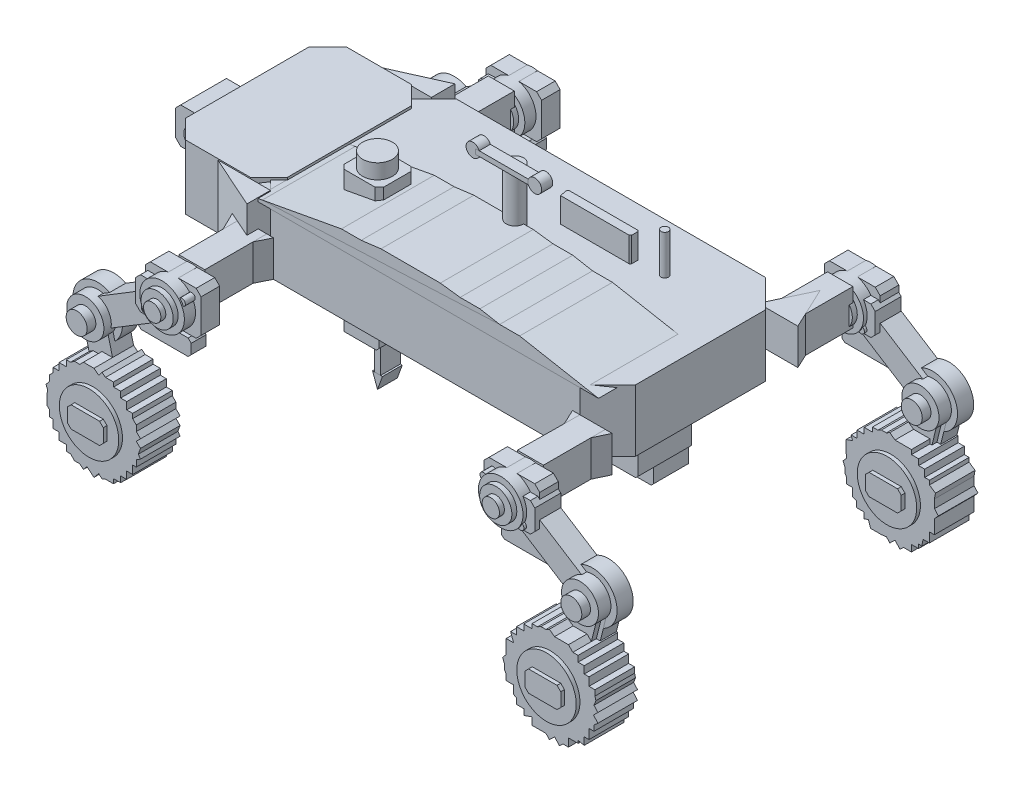
from build123d import *

# Parameters (mm, degrees)
V5_1_THICKER_CHAMFERED_MAIN_CHASSIS_DEPTH      = 100
V5_1_PROJECTING_FRONT_SENSOR_HEAD_DEPTH        = 104
V5_7_FRONT_NEAR_SHOULDER_DIAGONAL_FILL_N_DEPTH = 102
V5_7_FRONT_FAR_SHOULDER_DIAGONAL_FILL_NO_DEPTH = 102
SKETCH_5_W                                     = 42
SKETCH_5_H                                     = 100
V5_17_FRONT_NEAR_SIDE_100MM_OUTBOARD_BEA_DEPTH = 58
SKETCH_6_W                                     = 41
SKETCH_6_H                                     = 100
V5_17_REAR_NEAR_SIDE_100MM_OUTBOARD_BEAM_DEPTH = 58
SKETCH_7_W                                     = 42
SKETCH_7_H                                     = 100
V5_17_FRONT_FAR_SIDE_100MM_OUTBOARD_BEAM_DEPTH = 58
V5_17_REAR_FAR_SIDE_100MM_OUTBOARD_BEAM_DEPTH  = 58
V5_13_FRONT_NEAR_SIDE_COMPACT_ROOT_GUSSE_DEPTH = 58
V5_13_REAR_NEAR_SIDE_COMPACT_ROOT_GUSSET_DEPTH = 58
V5_13_FRONT_FAR_SIDE_COMPACT_ROOT_GUSSET_DEPTH = 58
V5_13_REAR_FAR_SIDE_COMPACT_ROOT_GUSSET_DEPTH  = 58
V5_1_NEAR_SEGMENTED_CURVED_UPPER_SHELL_DEPTH   = 150
V5_1_FAR_SEGMENTED_CURVED_UPPER_SHELL_DEPTH    = 150
V5_1_RECESSED_SIDE_PANEL_FRAME_DEPTH           = 74
V5_1_BATTERY_ELECTRONICS_PANEL_INSERT_DEPTH    = 82
V5_7_INTEGRATED_LOWER_SIDE_SKIRT_NO_LONG_DEPTH = 86
V5_7_PROTECTED_UNDERBODY_PAYLOAD_BAY_JOI_DEPTH = 60
V5_7_FRONT_SKID_VERTICAL_SUPPORT_JOINED_DEPTH  = 56
V5_7_CENTER_SKID_VERTICAL_SUPPORT_JOINED_DEPTH = 56
V5_7_REAR_SKID_VERTICAL_SUPPORT_JOINED_DEPTH   = 56
V5_1_FRONT_STEREO_CAMERA_BEZEL_DEPTH           = 74
SKETCH_23_R                                    = 15
V5_1_LEFT_RGB_CAMERA_LENS_DEPTH                = 84
SKETCH_24_R                                    = 15
V5_1_RIGHT_DEPTH_CAMERA_LENS_DEPTH             = 84
FRONT_NEAR_LEG_SIDE_HIP_MOUNT_PLATE_DEPTH      = 30
FRONT_NEAR_LEG_SIDE_FORK_CLEVIS_BLOCK_DEPTH    = 42
FRONT_NEAR_LEG_SIDE_CHAMFERED_GUSSET_BLO_DEPTH = 24
SKETCH_28_R                                    = 5.5
FRONT_NEAR_LEG_SIDE_UPPER_MOUNT_BOLT_DEPTH     = 46
SKETCH_29_R                                    = 5.5
FRONT_NEAR_LEG_SIDE_LOWER_MOUNT_BOLT_DEPTH     = 46
FRONT_NEAR_LEG_SIDE_UPPER_PARALLEL_LINK_DEPTH  = 34
FRONT_NEAR_LEG_SIDE_INNER_UPPER_LINK_DEPTH     = 26
FRONT_NEAR_LEG_SIDE_LOWER_PARALLEL_LINK_DEPTH  = 34
FRONT_NEAR_LEG_SIDE_INNER_LOWER_LINK_DEPTH     = 26
SKETCH_34_R                                    = 36
FRONT_NEAR_LEG_SIDE_HIP_JOINT_POD_DEPTH        = 48
SKETCH_35_R                                    = 26
FRONT_NEAR_LEG_SIDE_HIP_ANGLE_CONTROL_WA_DEPTH = 56
SKETCH_36_R                                    = 14
FRONT_NEAR_LEG_SIDE_HIP_PIN_CAP_DEPTH          = 64
SKETCH_37_R                                    = 30
FRONT_NEAR_LEG_SIDE_KNEE_JOINT_POD_DEPTH       = 46
SKETCH_38_R                                    = 40
FRONT_NEAR_LEG_SIDE_KNEE_OUTER_ANGLE_PLA_DEPTH = 26
SKETCH_39_R                                    = 17
FRONT_NEAR_LEG_SIDE_KNEE_PIN_CAP_DEPTH         = 60
SKETCH_40_R                                    = 30
FRONT_NEAR_LEG_SIDE_AXLE_JOINT_POD_DEPTH       = 46
SKETCH_41_R                                    = 21
FRONT_NEAR_LEG_SIDE_AXLE_PIN_CAP_DEPTH         = 58
FRONT_NEAR_LEG_SIDE_MOUNTED_BLOCK_TREAD_DEPTH  = 64
SKETCH_43_R                                    = 48
FRONT_NEAR_LEG_SIDE_SILVER_HUB_DISC_DEPTH      = 70
FRONT_NEAR_LEG_SIDE_RECTANGULAR_HUB_CAP_DEPTH  = 76
REAR_NEAR_LEG_SIDE_HIP_MOUNT_PLATE_DEPTH       = 30
REAR_NEAR_LEG_SIDE_FORK_CLEVIS_BLOCK_DEPTH     = 42
REAR_NEAR_LEG_SIDE_CHAMFERED_GUSSET_BLOC_DEPTH = 24
SKETCH_48_R                                    = 5.5
REAR_NEAR_LEG_SIDE_UPPER_MOUNT_BOLT_DEPTH      = 46
SKETCH_49_R                                    = 5.5
REAR_NEAR_LEG_SIDE_LOWER_MOUNT_BOLT_DEPTH      = 46
REAR_NEAR_LEG_SIDE_UPPER_PARALLEL_LINK_DEPTH   = 34
REAR_NEAR_LEG_SIDE_INNER_UPPER_LINK_DEPTH      = 26
REAR_NEAR_LEG_SIDE_LOWER_PARALLEL_LINK_DEPTH   = 34
REAR_NEAR_LEG_SIDE_INNER_LOWER_LINK_DEPTH      = 26
SKETCH_54_R                                    = 36
REAR_NEAR_LEG_SIDE_HIP_JOINT_POD_DEPTH         = 48
SKETCH_55_R                                    = 26
REAR_NEAR_LEG_SIDE_HIP_ANGLE_CONTROL_WAS_DEPTH = 56
SKETCH_56_R                                    = 14
REAR_NEAR_LEG_SIDE_HIP_PIN_CAP_DEPTH           = 64
SKETCH_57_R                                    = 29.877507243
REAR_NEAR_LEG_SIDE_KNEE_JOINT_POD_DEPTH        = 46
SKETCH_58_R                                    = 40
REAR_NEAR_LEG_SIDE_KNEE_OUTER_ANGLE_PLAT_DEPTH = 26
SKETCH_59_R                                    = 17
REAR_NEAR_LEG_SIDE_KNEE_PIN_CAP_DEPTH          = 60
SKETCH_60_R                                    = 30.007079554
REAR_NEAR_LEG_SIDE_AXLE_JOINT_POD_DEPTH        = 46
SKETCH_61_R                                    = 21
REAR_NEAR_LEG_SIDE_AXLE_PIN_CAP_DEPTH          = 58
REAR_NEAR_LEG_SIDE_MOUNTED_BLOCK_TREAD_T_DEPTH = 64
SKETCH_63_R                                    = 48
REAR_NEAR_LEG_SIDE_SILVER_HUB_DISC_DEPTH       = 70
REAR_NEAR_LEG_SIDE_RECTANGULAR_HUB_CAP_DEPTH   = 76
FRONT_FAR_LEG_SIDE_HIP_MOUNT_PLATE_DEPTH       = 30
FRONT_FAR_LEG_SIDE_FORK_CLEVIS_BLOCK_DEPTH     = 42
FRONT_FAR_LEG_SIDE_CHAMFERED_GUSSET_BLOC_DEPTH = 24
SKETCH_68_R                                    = 5.555512755
FRONT_FAR_LEG_SIDE_UPPER_MOUNT_BOLT_DEPTH      = 46
SKETCH_69_R                                    = 5.5
FRONT_FAR_LEG_SIDE_LOWER_MOUNT_BOLT_DEPTH      = 46
FRONT_FAR_LEG_SIDE_UPPER_PARALLEL_LINK_DEPTH   = 34
FRONT_FAR_LEG_SIDE_INNER_UPPER_LINK_DEPTH      = 26
FRONT_FAR_LEG_SIDE_LOWER_PARALLEL_LINK_DEPTH   = 34
FRONT_FAR_LEG_SIDE_INNER_LOWER_LINK_DEPTH      = 26
SKETCH_74_R                                    = 36
FRONT_FAR_LEG_SIDE_HIP_JOINT_POD_DEPTH         = 48
SKETCH_75_R                                    = 26
FRONT_FAR_LEG_SIDE_HIP_ANGLE_CONTROL_WAS_DEPTH = 56
SKETCH_76_R                                    = 14
FRONT_FAR_LEG_SIDE_HIP_PIN_CAP_DEPTH           = 64
SKETCH_77_R                                    = 30
FRONT_FAR_LEG_SIDE_KNEE_JOINT_POD_DEPTH        = 46
SKETCH_78_R                                    = 40
FRONT_FAR_LEG_SIDE_KNEE_OUTER_ANGLE_PLAT_DEPTH = 26
SKETCH_79_R                                    = 17
FRONT_FAR_LEG_SIDE_KNEE_PIN_CAP_DEPTH          = 60
SKETCH_80_R                                    = 30
FRONT_FAR_LEG_SIDE_AXLE_JOINT_POD_DEPTH        = 46
SKETCH_81_R                                    = 21
FRONT_FAR_LEG_SIDE_AXLE_PIN_CAP_DEPTH          = 58
FRONT_FAR_LEG_SIDE_MOUNTED_BLOCK_TREAD_T_DEPTH = 64
SKETCH_83_R                                    = 48
FRONT_FAR_LEG_SIDE_SILVER_HUB_DISC_DEPTH       = 70
FRONT_FAR_LEG_SIDE_RECTANGULAR_HUB_CAP_DEPTH   = 76
REAR_FAR_LEG_SIDE_HIP_MOUNT_PLATE_DEPTH        = 30
REAR_FAR_LEG_SIDE_FORK_CLEVIS_BLOCK_DEPTH      = 42
REAR_FAR_LEG_SIDE_CHAMFERED_GUSSET_BLOCK_DEPTH = 24
SKETCH_88_R                                    = 5.5
REAR_FAR_LEG_SIDE_UPPER_MOUNT_BOLT_DEPTH       = 46
SKETCH_89_R                                    = 5.566740906
REAR_FAR_LEG_SIDE_LOWER_MOUNT_BOLT_DEPTH       = 46
REAR_FAR_LEG_SIDE_UPPER_PARALLEL_LINK_DEPTH    = 34
REAR_FAR_LEG_SIDE_INNER_UPPER_LINK_DEPTH       = 26
REAR_FAR_LEG_SIDE_LOWER_PARALLEL_LINK_DEPTH    = 34
REAR_FAR_LEG_SIDE_INNER_LOWER_LINK_DEPTH       = 26
SKETCH_94_R                                    = 36
REAR_FAR_LEG_SIDE_HIP_JOINT_POD_DEPTH          = 48
SKETCH_95_R                                    = 26
REAR_FAR_LEG_SIDE_HIP_ANGLE_CONTROL_WASH_DEPTH = 56
SKETCH_96_R                                    = 14
REAR_FAR_LEG_SIDE_HIP_PIN_CAP_DEPTH            = 64
SKETCH_97_R                                    = 30
REAR_FAR_LEG_SIDE_KNEE_JOINT_POD_DEPTH         = 46
SKETCH_98_R                                    = 40
REAR_FAR_LEG_SIDE_KNEE_OUTER_ANGLE_PLATE_DEPTH = 26
SKETCH_99_R                                    = 17
REAR_FAR_LEG_SIDE_KNEE_PIN_CAP_DEPTH           = 60
SKETCH_100_R                                   = 30
REAR_FAR_LEG_SIDE_AXLE_JOINT_POD_DEPTH         = 46
SKETCH_101_R                                   = 21
REAR_FAR_LEG_SIDE_AXLE_PIN_CAP_DEPTH           = 58
REAR_FAR_LEG_SIDE_MOUNTED_BLOCK_TREAD_TI_DEPTH = 64
SKETCH_103_R                                   = 48
REAR_FAR_LEG_SIDE_SILVER_HUB_DISC_DEPTH        = 70
REAR_FAR_LEG_SIDE_RECTANGULAR_HUB_CAP_DEPTH    = 76
V5_1_ROOF_LIDAR_RTK_BASE_DEPTH                 = 142
SKETCH_106_R                                   = 24
V5_1_LIDAR_RTK_CYLINDRICAL_PUCK_DEPTH          = 166
SKETCH_107_R                                   = 14
V5_1_TALL_ENVIRONMENT_WEATHER_MAST_DEPTH       = 208
SKETCH_108_W                                   = 92
SKETCH_108_H                                   = 8
V5_1_ANEMOMETER_CROSSBAR_DEPTH                 = 18
SKETCH_109_R                                   = 11
V5_1_LEFT_WIND_CUP_DEPTH                       = 18
SKETCH_110_R                                   = 11
V5_1_RIGHT_WIND_CUP_DEPTH                      = 18
SKETCH_111_R                                   = 6
V5_1_SHORT_TELEMETRY_ANTENNA_DEPTH             = 164
V5_1_SILVER_TOP_SERVICE_HANDLE_BAR_DEPTH       = 140
V5_7_SOIL_PROBE_MOUNTING_COLLAR_JOINED_T_DEPTH = 60
SKETCH_114_W                                   = 10
SKETCH_114_H                                   = 92
V5_1_DOWNWARD_SOIL_MOISTURE_PROBE_ROD_DEPTH    = 32
V5_1_SOIL_PROBE_TAPERED_TIP_DEPTH              = 32


with BuildPart() as part:
    # 草图1 → v5_1_thicker_chamfered_main_chassis (new body)
    with BuildSketch(Plane(origin=(0, 0, 0), x_dir=(1, 0, 0), z_dir=(0, 1, 0))):
        Polygon((-225, -150), (275, -150), (320, -105), (320, 105), (275, 150), (-225, 150), (-270, 105), (-270, -105), align=None)
    extrude(amount=V5_1_THICKER_CHAMFERED_MAIN_CHASSIS_DEPTH)

    # 草图17 → v5_7_integrated_lower_side_skirt_no_long_gap (add)
    with BuildSketch(Plane.XY):
        Polygon((-191, -49), (301, -49), (305, -45), (305, 9), (301, 13), (-191, 13), (-195, 9), (-195, -45), align=None)
    extrude(amount=V5_7_INTEGRATED_LOWER_SIDE_SKIRT_NO_LONG_DEPTH)

    # 草图18 → v5_7_protected_underbody_payload_bay_joined (add)
    with BuildSketch(Plane.XY):
        Polygon((-135, -76), (15, -76), (20, -71), (20, -37), (15, -32), (-135, -32), (-140, -37), (-140, -71), align=None)
    extrude(amount=V5_7_PROTECTED_UNDERBODY_PAYLOAD_BAY_JOI_DEPTH)

    # 草图19 → v5_7_front_skid_vertical_support_joined (add)
    with BuildSketch(Plane.XY):
        Polygon((-181, -77), (-159, -77), (-155, -73), (-155, -15), (-159, -11), (-181, -11), (-185, -15), (-185, -73), align=None)
    extrude(amount=V5_7_FRONT_SKID_VERTICAL_SUPPORT_JOINED_DEPTH)

    # 草图20 → v5_7_center_skid_vertical_support_joined (add)
    with BuildSketch(Plane.XY):
        Polygon((29, -77), (51, -77), (55, -73), (55, -15), (51, -11), (29, -11), (25, -15), (25, -73), align=None)
    extrude(amount=V5_7_CENTER_SKID_VERTICAL_SUPPORT_JOINED_DEPTH)

    # 草图21 → v5_7_rear_skid_vertical_support_joined (add)
    with BuildSketch(Plane.XY):
        Polygon((274, -77), (296, -77), (300, -73), (300, -15), (296, -11), (274, -11), (270, -15), (270, -73), align=None)
    extrude(amount=V5_7_REAR_SKID_VERTICAL_SUPPORT_JOINED_DEPTH)

    # 草图113 → v5_7_soil_probe_mounting_collar_joined_to_underbody (add)
    with BuildSketch(Plane.XY):
        Polygon((-196, -106), (-144, -106), (-140, -102), (-140, -46), (-144, -42), (-195, -42), (-196, -42), align=None)
    extrude(amount=V5_7_SOIL_PROBE_MOUNTING_COLLAR_JOINED_T_DEPTH)


with BuildPart() as body_2:
    # 草图2 → v5_1_projecting_front_sensor_head (new body)
    with BuildSketch(Plane(origin=(0, 0, 0), x_dir=(1, 0, 0), z_dir=(0, 1, 0))):
        Polygon((-382.5, -130), (-277.5, -130), (-247.5, -100), (-247.5, 100), (-277.5, 130), (-382.5, 130), (-412.5, 100), (-412.5, -100), align=None)
    extrude(amount=V5_1_PROJECTING_FRONT_SENSOR_HEAD_DEPTH)


with BuildPart() as body_3:
    # 草图3 → v5_7_front_near_shoulder_diagonal_fill_no_gap (new body)
    with BuildSketch(Plane(origin=(0, 0, 0), x_dir=(1, 0, 0), z_dir=(0, 1, 0))):
        Polygon((-330, 130), (-245, 130), (-245, 168), align=None)
    extrude(amount=V5_7_FRONT_NEAR_SHOULDER_DIAGONAL_FILL_N_DEPTH)


with BuildPart() as body_4:
    # 草图4 → v5_7_front_far_shoulder_diagonal_fill_no_gap (new body)
    with BuildSketch(Plane(origin=(0, 0, 0), x_dir=(1, 0, 0), z_dir=(0, 1, 0))):
        Polygon((-330, -130), (-245, -130), (-245, -168), align=None)
    extrude(amount=V5_7_FRONT_FAR_SHOULDER_DIAGONAL_FILL_NO_DEPTH)


with BuildPart() as body_5:
    # 草图5 → v5_17_front_near_side_100mm_outboard_beam_connected (new body)
    with BuildSketch(Plane(origin=(0, 0, 0), x_dir=(1, 0, 0), z_dir=(0, 1, 0))):
        with Locations((-252, 200)):
            Rectangle(SKETCH_5_W, SKETCH_5_H)
    extrude(amount=V5_17_FRONT_NEAR_SIDE_100MM_OUTBOARD_BEA_DEPTH)


with BuildPart() as body_6:
    # 草图6 → v5_17_rear_near_side_100mm_outboard_beam_connected (new body)
    with BuildSketch(Plane(origin=(0, 0, 0), x_dir=(1, 0, 0), z_dir=(0, 1, 0))):
        with Locations((295.5, 200)):
            Rectangle(SKETCH_6_W, SKETCH_6_H)
    extrude(amount=V5_17_REAR_NEAR_SIDE_100MM_OUTBOARD_BEAM_DEPTH)


with BuildPart() as body_7:
    # 草图7 → v5_17_front_far_side_100mm_outboard_beam_connected (new body)
    with BuildSketch(Plane(origin=(0, 0, 0), x_dir=(1, 0, 0), z_dir=(0, 1, 0))):
        with Locations((-252, -200)):
            Rectangle(SKETCH_7_W, SKETCH_7_H)
    extrude(amount=V5_17_FRONT_FAR_SIDE_100MM_OUTBOARD_BEAM_DEPTH)


with BuildPart() as body_8:
    # 草图8 → v5_17_rear_far_side_100mm_outboard_beam_connected (new body)
    with BuildSketch(Plane(origin=(0, 0, 0), x_dir=(1, 0, 0), z_dir=(0, 1, 0))):
        Polygon((274, -250), (316, -250), (316, -150), (275, -150), align=None)
    extrude(amount=V5_17_REAR_FAR_SIDE_100MM_OUTBOARD_BEAM_DEPTH)


with BuildPart() as body_9:
    # 草图9 → v5_13_front_near_side_compact_root_gusset (new body)
    with BuildSketch(Plane(origin=(0, 0, 0), x_dir=(1, 0, 0), z_dir=(0, 1, 0))):
        Polygon((-287.5, 149), (-220, 150), (-253.75, 218), align=None)
    extrude(amount=V5_13_FRONT_NEAR_SIDE_COMPACT_ROOT_GUSSE_DEPTH)


with BuildPart() as body_10:
    # 草图10 → v5_13_rear_near_side_compact_root_gusset (new body)
    with BuildSketch(Plane(origin=(0, 0, 0), x_dir=(1, 0, 0), z_dir=(0, 1, 0))):
        Polygon((263, 150), (327, 150), (295, 218), align=None)
    extrude(amount=V5_13_REAR_NEAR_SIDE_COMPACT_ROOT_GUSSET_DEPTH)


with BuildPart() as body_11:
    # 草图11 → v5_13_front_far_side_compact_root_gusset (new body)
    with BuildSketch(Plane(origin=(0, 0, 0), x_dir=(1, 0, 0), z_dir=(0, 1, 0))):
        Polygon((-287.5, -149), (-220, -150), (-253.75, -218), align=None)
    extrude(amount=V5_13_FRONT_FAR_SIDE_COMPACT_ROOT_GUSSET_DEPTH)


with BuildPart() as body_12:
    # 草图12 → v5_13_rear_far_side_compact_root_gusset (new body)
    with BuildSketch(Plane(origin=(0, 0, 0), x_dir=(1, 0, 0), z_dir=(0, 1, 0))):
        Polygon((263, -150), (327, -150), (295, -218), align=None)
    extrude(amount=V5_13_REAR_FAR_SIDE_COMPACT_ROOT_GUSSET_DEPTH)


with BuildPart() as body_13:
    # 草图13 → v5_1_near_segmented_curved_upper_shell (new body)
    with BuildSketch(Plane.XY):
        Polygon((-270, 96), (305, 96), (273.055555556, 101.904038041), (241.14317141, 107.802150631), (209.293933726, 113.688592362), (177.537009993, 119.557972438), (145.277777778, 119.557972438), (113.333333333, 125.444863729), (81.388888889, 125.444863729), (49.444444444, 129.483463602), (17.5, 129.483463602), (-14.444444444, 129.483463602), (-46.388888889, 129.483463602), (-78.333333333, 125.444863729), (-110.277777778, 125.444863729), (-142.222222222, 119.557972438), (-174.071644358, 113.688592362), (-206.013649328, 107.802150631), (-238.018984687, 101.904038041), align=None)
    extrude(amount=V5_1_NEAR_SEGMENTED_CURVED_UPPER_SHELL_DEPTH)


with BuildPart() as body_14:
    # 草图14 → v5_1_far_segmented_curved_upper_shell (new body)
    with BuildSketch(Plane.XY):
        Polygon((-270, 96), (305, 96), (273.055555556, 101.904038041), (241.268504996, 107.778986219), (209.293933726, 113.688592362), (177.537009993, 119.557972438), (145.277777778, 119.557972438), (113.333333333, 125.444863729), (81.388888889, 125.444863729), (49.444444444, 129.483463602), (17.5, 129.483463602), (-14.444444444, 129.483463602), (-46.388888889, 129.483463602), (-78.333333333, 125.444863729), (-110.277777778, 125.444863729), (-142.222222222, 119.557972438), (-174.148381232, 113.674450885), (-206.139347974, 107.778986219), (-238.018984687, 101.904038041), align=None)
    extrude(amount=V5_1_FAR_SEGMENTED_CURVED_UPPER_SHELL_DEPTH)


with BuildPart() as body_15:
    # 草图15 → v5_1_recessed_side_panel_frame (new body)
    with BuildSketch(Plane.XY):
        Polygon((10.5, 14), (199.5, 14), (207.5, 22), (207.5, 82), (199.5, 90), (10.5, 90), (0, 79.5), (0, 22), align=None)
    extrude(amount=V5_1_RECESSED_SIDE_PANEL_FRAME_DEPTH)


with BuildPart() as body_16:
    # 草图16 → v5_1_battery_electronics_panel_insert (new body)
    with BuildSketch(Plane.XY):
        Polygon((31, 28), (179, 28), (184, 33), (184, 75), (179, 80), (31, 80), (26, 75), (26, 33), align=None)
    extrude(amount=V5_1_BATTERY_ELECTRONICS_PANEL_INSERT_DEPTH)


with BuildPart() as body_17:
    # 草图22 → v5_1_front_stereo_camera_bezel (new body)
    with BuildSketch(Plane.XY):
        Polygon((-446, 35), (-338, 35), (-330, 43), (-330, 85), (-338, 93), (-446, 93), (-454, 85), (-454, 43), align=None)
    extrude(amount=V5_1_FRONT_STEREO_CAMERA_BEZEL_DEPTH)


with BuildPart() as body_18:
    # 草图23 → v5_1_left_rgb_camera_lens (new body)
    with BuildSketch(Plane.XY):
        with Locations((-416, 66)):
            Circle(SKETCH_23_R)
    extrude(amount=V5_1_LEFT_RGB_CAMERA_LENS_DEPTH)


with BuildPart() as body_19:
    # 草图24 → v5_1_right_depth_camera_lens (new body)
    with BuildSketch(Plane.XY):
        with Locations((-370, 66)):
            Circle(SKETCH_24_R)
    extrude(amount=V5_1_RIGHT_DEPTH_CAMERA_LENS_DEPTH)


with BuildPart() as body_20:
    # 草图25 → front_near_leg_side_hip_mount_plate (new body)
    with BuildSketch(Plane.XY.offset(250)):
        Polygon((-289, -15), (-215, -15), (-207, -7), (-207, 47), (-215, 55), (-289, 55), (-297, 47), (-297, -7), align=None)
    extrude(amount=FRONT_NEAR_LEG_SIDE_HIP_MOUNT_PLATE_DEPTH)


with BuildPart() as body_21:
    # 草图26 → front_near_leg_side_fork_clevis_block (new body)
    with BuildSketch(Plane.XY.offset(250)):
        Polygon((-293, -11), (-246, -11), (-238, -3), (-238, 33), (-246, 41), (-293, 41), (-301, 33), (-301, -3), align=None)
    extrude(amount=FRONT_NEAR_LEG_SIDE_FORK_CLEVIS_BLOCK_DEPTH)


with BuildPart() as body_22:
    # 草图27 → front_near_leg_side_chamfered_gusset_block (new body)
    with BuildSketch(Plane.XY.offset(250)):
        Polygon((-310, -53), (-234, -53), (-229, -48), (-229, -32), (-234, -27), (-310, -27), (-315, -32), (-315, -48), align=None)
    extrude(amount=FRONT_NEAR_LEG_SIDE_CHAMFERED_GUSSET_BLO_DEPTH)


with BuildPart() as body_23:
    # 草图28 → front_near_leg_side_upper_mount_bolt (new body)
    with BuildSketch(Plane.XY.offset(250)):
        with Locations((-222, 40)):
            Circle(SKETCH_28_R)
    extrude(amount=FRONT_NEAR_LEG_SIDE_UPPER_MOUNT_BOLT_DEPTH)


with BuildPart() as body_24:
    # 草图29 → front_near_leg_side_lower_mount_bolt (new body)
    with BuildSketch(Plane.XY.offset(250)):
        with Locations((-282, 0)):
            Circle(SKETCH_29_R)
    extrude(amount=FRONT_NEAR_LEG_SIDE_LOWER_MOUNT_BOLT_DEPTH)


with BuildPart() as body_25:
    # 草图30 → front_near_leg_side_upper_parallel_link (new body)
    with BuildSketch(Plane.XY.offset(250)):
        Polygon((-241.279837267, 0), (-367.279837267, -76.884256305), (-388.111687363, -42.744456581), (-261.334784086, 34.613860284), align=None)
    extrude(amount=FRONT_NEAR_LEG_SIDE_UPPER_PARALLEL_LINK_DEPTH)


with BuildPart() as body_26:
    # 草图31 → front_near_leg_side_inner_upper_link (new body)
    with BuildSketch(Plane.XY.offset(250)):
        Polygon((-262.17592677, 0), (-388.17592677, -77.597915337), (-397.614039026, -62.272733739), (-270.751527953, 15.856364623), align=None)
    extrude(amount=FRONT_NEAR_LEG_SIDE_INNER_UPPER_LINK_DEPTH)


with BuildPart() as body_27:
    # 草图32 → front_near_leg_side_lower_parallel_link (new body)
    with BuildSketch(Plane.XY.offset(250)):
        Polygon((-358.597149997, -55.149287499), (-328.597149997, -175.149287499), (-367.402850003, -184.850712501), (-396.404882451, -64.236107726), align=None)
    extrude(amount=FRONT_NEAR_LEG_SIDE_LOWER_PARALLEL_LINK_DEPTH)


with BuildPart() as body_28:
    # 草图33 → front_near_leg_side_inner_lower_link (new body)
    with BuildSketch(Plane.XY.offset(250)):
        Polygon((-384.268717499, -67.817179375), (-354.268717499, -187.817179375), (-369.268717499, -191.567179375), (-399.268717499, -71.567179375), align=None)
    extrude(amount=FRONT_NEAR_LEG_SIDE_INNER_LOWER_LINK_DEPTH)


with BuildPart() as body_29:
    # 草图34 → front_near_leg_side_hip_joint_pod (new body)
    with BuildSketch(Plane.XY.offset(250)):
        with Locations((-252, 20)):
            Circle(SKETCH_34_R)
    extrude(amount=FRONT_NEAR_LEG_SIDE_HIP_JOINT_POD_DEPTH)


with BuildPart() as body_30:
    # 草图35 → front_near_leg_side_hip_angle_control_washer (new body)
    with BuildSketch(Plane.XY.offset(250)):
        with Locations((-252, 20)):
            Circle(SKETCH_35_R)
    extrude(amount=FRONT_NEAR_LEG_SIDE_HIP_ANGLE_CONTROL_WA_DEPTH)


with BuildPart() as body_31:
    # 草图36 → front_near_leg_side_hip_pin_cap (new body)
    with BuildSketch(Plane.XY.offset(250)):
        with Locations((-252, 20)):
            Circle(SKETCH_36_R)
    extrude(amount=FRONT_NEAR_LEG_SIDE_HIP_PIN_CAP_DEPTH)


with BuildPart() as body_32:
    # 草图37 → front_near_leg_side_knee_joint_pod (new body)
    with BuildSketch(Plane.XY.offset(250)):
        with Locations((-378, -60)):
            Circle(SKETCH_37_R)
    extrude(amount=FRONT_NEAR_LEG_SIDE_KNEE_JOINT_POD_DEPTH)


with BuildPart() as body_33:
    # 草图38 → front_near_leg_side_knee_outer_angle_plate (new body)
    with BuildSketch(Plane.XY.offset(250)):
        with Locations((-378, -60)):
            Circle(SKETCH_38_R)
    extrude(amount=FRONT_NEAR_LEG_SIDE_KNEE_OUTER_ANGLE_PLA_DEPTH)


with BuildPart() as body_34:
    # 草图39 → front_near_leg_side_knee_pin_cap (new body)
    with BuildSketch(Plane.XY.offset(250)):
        with Locations((-378, -60)):
            Circle(SKETCH_39_R)
    extrude(amount=FRONT_NEAR_LEG_SIDE_KNEE_PIN_CAP_DEPTH)


with BuildPart() as body_35:
    # 草图40 → front_near_leg_side_axle_joint_pod (new body)
    with BuildSketch(Plane.XY.offset(250)):
        with Locations((-348, -180)):
            Circle(SKETCH_40_R)
    extrude(amount=FRONT_NEAR_LEG_SIDE_AXLE_JOINT_POD_DEPTH)


with BuildPart() as body_36:
    # 草图41 → front_near_leg_side_axle_pin_cap (new body)
    with BuildSketch(Plane.XY.offset(250)):
        with Locations((-348, -180)):
            Circle(SKETCH_41_R)
    extrude(amount=FRONT_NEAR_LEG_SIDE_AXLE_PIN_CAP_DEPTH)


with BuildPart() as body_37:
    # 草图42 → front_near_leg_side_mounted_block_tread_tire (new body)
    with BuildSketch(Plane.XY.offset(250)):
        Polygon((-271, -180), (-277.650550685, -173.349449315), (-270.879339992, -166.578238622), (-277.650550685, -159.807027929), (-277.650550685, -150.533375708), (-283.518342469, -144.665583923), (-283.518342469, -137.221092057), (-293.116257811, -137.221092057), (-293.116257811, -125.552777849), (-302.958076824, -125.552777849), (-302.958076824, -115.976839853), (-314.530831685, -115.976839853), (-314.530831685, -108.861275997), (-327.389787915, -108.861275997), (-332.978045205, -104.479533409), (-338.408784826, -111.405629515), (-346.026280737, -105.432764539), (-354.959216963, -105.432764539), (-363.021954795, -105.432764539), (-368.994819772, -111.405629515), (-377.466624292, -111.405629515), (-383.963715854, -115.976839853), (-390.778907943, -115.976839853), (-390.778907943, -125.552777849), (-402.447222151, -125.552777849), (-402.447222151, -137.221092057), (-412.023160147, -137.221092057), (-412.023160147, -144.665583923), (-417.890951932, -150.533375708), (-417.890951932, -159.807027929), (-423.520466591, -166.578238622), (-420.705709261, -173.349449315), (-422.113087926, -180), (-422.113087926, -186.959216963), (-422.113087926, -195.021954795), (-417.890951932, -199.24409079), (-417.890951932, -209.466624292), (-412.023160147, -209.466624292), (-412.023160147, -222.778907943), (-402.447222151, -222.778907943), (-402.447222151, -234.447222151), (-390.778907943, -234.447222151), (-390.778907943, -244.023160147), (-383.963715854, -244.023160147), (-377.466624292, -250.520251709), (-368.994819772, -250.520251709), (-363.021954795, -255.520466591), (-357.306422913, -248.693139964), (-346.026280737, -258.136369469), (-338.408784826, -249.037105615), (-332.978045205, -253.583477445), (-327.389787915, -251.31029153), (-314.530831685, -251.31029153), (-314.530831685, -244.023160147), (-302.958076824, -244.023160147), (-302.958076824, -234.447222151), (-293.116257811, -234.447222151), (-293.116257811, -222.778907943), (-283.518342469, -222.778907943), (-283.518342469, -209.466624292), (-277.650550685, -209.466624292), (-277.650550685, -199.24409079), (-271, -195.021954795), (-274.325275342, -189.784105461), align=None)
    extrude(amount=FRONT_NEAR_LEG_SIDE_MOUNTED_BLOCK_TREAD_DEPTH)


with BuildPart() as body_38:
    # 草图43 → front_near_leg_side_silver_hub_disc (new body)
    with BuildSketch(Plane.XY.offset(250)):
        with Locations((-348, -180)):
            Circle(SKETCH_43_R)
    extrude(amount=FRONT_NEAR_LEG_SIDE_SILVER_HUB_DISC_DEPTH)


with BuildPart() as body_39:
    # 草图44 → front_near_leg_side_rectangular_hub_cap (new body)
    with BuildSketch(Plane.XY.offset(250)):
        Polygon((-371, -197), (-325, -197), (-319, -191), (-319, -169), (-325, -163), (-371, -163), (-377, -169), (-377, -191), align=None)
    extrude(amount=FRONT_NEAR_LEG_SIDE_RECTANGULAR_HUB_CAP_DEPTH)


with BuildPart() as body_40:
    # 草图45 → rear_near_leg_side_hip_mount_plate (new body)
    with BuildSketch(Plane.XY.offset(250)):
        Polygon((258, -15), (332, -15), (340, -7), (340, 47), (332, 55), (258, 55), (250, 47), (250, -7), align=None)
    extrude(amount=REAR_NEAR_LEG_SIDE_HIP_MOUNT_PLATE_DEPTH)


with BuildPart() as body_41:
    # 草图46 → rear_near_leg_side_fork_clevis_block (new body)
    with BuildSketch(Plane.XY.offset(250)):
        Polygon((289, -7), (337, -7), (344, 0), (344, 33), (337, 40), (289, 40), (282, 33), (282, 0), align=None)
    extrude(amount=REAR_NEAR_LEG_SIDE_FORK_CLEVIS_BLOCK_DEPTH)


with BuildPart() as body_42:
    # 草图47 → rear_near_leg_side_chamfered_gusset_block (new body)
    with BuildSketch(Plane.XY.offset(250)):
        Polygon((277, -53), (353, -53), (358, -48), (358, -32), (353, -27), (277, -27), (272, -32), (272, -49), align=None)
    extrude(amount=REAR_NEAR_LEG_SIDE_CHAMFERED_GUSSET_BLOC_DEPTH)


with BuildPart() as body_43:
    # 草图48 → rear_near_leg_side_upper_mount_bolt (new body)
    with BuildSketch(Plane.XY.offset(250)):
        with Locations((265, 40)):
            Circle(SKETCH_48_R)
    extrude(amount=REAR_NEAR_LEG_SIDE_UPPER_MOUNT_BOLT_DEPTH)


with BuildPart() as body_44:
    # 草图49 → rear_near_leg_side_lower_mount_bolt (new body)
    with BuildSketch(Plane.XY.offset(250)):
        with Locations((325, 0)):
            Circle(SKETCH_49_R)
    extrude(amount=REAR_NEAR_LEG_SIDE_LOWER_MOUNT_BOLT_DEPTH)


with BuildPart() as body_45:
    # 草图50 → rear_near_leg_side_upper_parallel_link (new body)
    with BuildSketch(Plane.XY.offset(250)):
        Polygon((305.720162733, 36.884256305), (431.720162733, -43.115743695), (410.279837267, -76.884256305), (282, 4.56325942), align=None)
    extrude(amount=REAR_NEAR_LEG_SIDE_UPPER_PARALLEL_LINK_DEPTH)


with BuildPart() as body_46:
    # 草图51 → rear_near_leg_side_inner_upper_link (new body)
    with BuildSketch(Plane.XY.offset(250)):
        Polygon((314.82407323, 17.597915337), (440.82407323, -62.402084663), (431.17592677, -77.597915337), (308.959210114, 0), align=None)
    extrude(amount=REAR_NEAR_LEG_SIDE_INNER_UPPER_LINK_DEPTH)


with BuildPart() as body_47:
    # 草图52 → rear_near_leg_side_lower_parallel_link (new body)
    with BuildSketch(Plane.XY.offset(250)):
        Polygon((440.82407323, -62.402084663), (410.402850003, -184.850712501), (371.58299089, -175.206279398), (401.420912284, -55.105502878), align=None)
    extrude(amount=REAR_NEAR_LEG_SIDE_LOWER_PARALLEL_LINK_DEPTH)


with BuildPart() as body_48:
    # 草图53 → rear_near_leg_side_inner_lower_link (new body)
    with BuildSketch(Plane.XY.offset(250)):
        Polygon((444.731282501, -72.182820625), (414.731282501, -192.182820625), (397.268717499, -192.182820625), (427.268717499, -72.182820625), align=None)
    extrude(amount=REAR_NEAR_LEG_SIDE_INNER_LOWER_LINK_DEPTH)


with BuildPart() as body_49:
    # 草图54 → rear_near_leg_side_hip_joint_pod (new body)
    with BuildSketch(Plane.XY.offset(250)):
        with Locations((295, 20)):
            Circle(SKETCH_54_R)
    extrude(amount=REAR_NEAR_LEG_SIDE_HIP_JOINT_POD_DEPTH)


with BuildPart() as body_50:
    # 草图55 → rear_near_leg_side_hip_angle_control_washer (new body)
    with BuildSketch(Plane.XY.offset(250)):
        with Locations((295, 20)):
            Circle(SKETCH_55_R)
    extrude(amount=REAR_NEAR_LEG_SIDE_HIP_ANGLE_CONTROL_WAS_DEPTH)


with BuildPart() as body_51:
    # 草图56 → rear_near_leg_side_hip_pin_cap (new body)
    with BuildSketch(Plane.XY.offset(250)):
        with Locations((295, 20)):
            Circle(SKETCH_56_R)
    extrude(amount=REAR_NEAR_LEG_SIDE_HIP_PIN_CAP_DEPTH)


with BuildPart() as body_52:
    # 草图57 → rear_near_leg_side_knee_joint_pod (new body)
    with BuildSketch(Plane.XY.offset(250)):
        with Locations((421.122492757, -58.75379377)):
            Circle(SKETCH_57_R)
    extrude(amount=REAR_NEAR_LEG_SIDE_KNEE_JOINT_POD_DEPTH)


with BuildPart() as body_53:
    # 草图58 → rear_near_leg_side_knee_outer_angle_plate (new body)
    with BuildSketch(Plane.XY.offset(250)):
        with Locations((421, -60)):
            Circle(SKETCH_58_R)
    extrude(amount=REAR_NEAR_LEG_SIDE_KNEE_OUTER_ANGLE_PLAT_DEPTH)


with BuildPart() as body_54:
    # 草图59 → rear_near_leg_side_knee_pin_cap (new body)
    with BuildSketch(Plane.XY.offset(250)):
        with Locations((421, -60)):
            Circle(SKETCH_59_R)
    extrude(amount=REAR_NEAR_LEG_SIDE_KNEE_PIN_CAP_DEPTH)


with BuildPart() as body_55:
    # 草图60 → rear_near_leg_side_axle_joint_pod (new body)
    with BuildSketch(Plane.XY.offset(250)):
        with Locations((390.992920446, -180.028495949)):
            Circle(SKETCH_60_R)
    extrude(amount=REAR_NEAR_LEG_SIDE_AXLE_JOINT_POD_DEPTH)


with BuildPart() as body_56:
    # 草图61 → rear_near_leg_side_axle_pin_cap (new body)
    with BuildSketch(Plane.XY.offset(250)):
        with Locations((391, -180)):
            Circle(SKETCH_61_R)
    extrude(amount=REAR_NEAR_LEG_SIDE_AXLE_PIN_CAP_DEPTH)


with BuildPart() as body_57:
    # 草图62 → rear_near_leg_side_mounted_block_tread_tire (new body)
    with BuildSketch(Plane.XY.offset(250)):
        Polygon((468, -180), (461.658115594, -173.040783037), (464.829057797, -164.978045205), (463.243586695, -159.389787915), (463.243586695, -150.533375708), (453.616409769, -150.533375708), (453.616409769, -137.221092057), (445.883742189, -137.221092057), (445.883742189, -125.552777849), (436.041923176, -125.552777849), (436.041923176, -115.976839853), (427.513923368, -115.976839853), (420.432491902, -108.895408387), (411.610212085, -108.895408387), (406.021954795, -108.895408387), (397.959216963, -108.895408387), (389.607894365, -102.654144297), (384.040783037, -105.774776342), (375.978045205, -105.774776342), (370.389787915, -108.895408387), (361.533375708, -108.895408387), (361.533375708, -115.976839853), (348.221092057, -115.976839853), (348.221092057, -125.552777849), (336.552777849, -125.552777849), (336.552777849, -137.221092057), (326.976839853, -137.221092057), (331.764808851, -150.533375708), (319.861275997, -150.533375708), (319.861275997, -159.389787915), (319.861275997, -164.978045205), (319.861275997, -173.040783037), (314, -180), (316.930637998, -186.959216963), (316.930637998, -195.021954795), (319.861275997, -200.610212085), (319.861275997, -209.466624292), (331.764808851, -209.466624292), (331.764808851, -222.778907943), (336.116257811, -225.041923176), (336.116257811, -234.447222151), (348.221092057, -234.447222151), (348.221092057, -244.023160147), (361.533375708, -239.235191149), (361.533375708, -251.138724003), (370.389787915, -251.138724003), (375.978045205, -251.138724003), (384.040783037, -251.138724003), (389.607894365, -257), (397.959216963, -249.067812082), (406.021954795, -257.556582816), (411.610212085, -252.24878798), (420.432491902, -252.24878798), (420.432491902, -239.235191149), (436.041923176, -239.235191149), (436.041923176, -234.883742189), (445.883742189, -237.059466669), (445.883742189, -225.041923176), (453.616409769, -225.041923176), (453.616409769, -209.466624292), (461.658115594, -209.466624292), (461.658115594, -200.610212085), (468, -195.021954795), (460.895383993, -186.959216963), align=None)
    extrude(amount=REAR_NEAR_LEG_SIDE_MOUNTED_BLOCK_TREAD_T_DEPTH)


with BuildPart() as body_58:
    # 草图63 → rear_near_leg_side_silver_hub_disc (new body)
    with BuildSketch(Plane.XY.offset(250)):
        with Locations((391, -180)):
            Circle(SKETCH_63_R)
    extrude(amount=REAR_NEAR_LEG_SIDE_SILVER_HUB_DISC_DEPTH)


with BuildPart() as body_59:
    # 草图64 → rear_near_leg_side_rectangular_hub_cap (new body)
    with BuildSketch(Plane.XY.offset(250)):
        Polygon((368, -197), (414, -197), (420, -191), (420, -169), (414, -163), (368, -163), (362, -169), (362, -191), align=None)
    extrude(amount=REAR_NEAR_LEG_SIDE_RECTANGULAR_HUB_CAP_DEPTH)


with BuildPart() as body_60:
    # 草图65 → front_far_leg_side_hip_mount_plate (new body)
    with BuildSketch(Plane.XY):
        Polygon((-289, -15), (-215, -15), (-207, -7), (-207, 47), (-215, 55), (-289, 55), (-297, 47), (-297, -7), align=None)
    extrude(amount=FRONT_FAR_LEG_SIDE_HIP_MOUNT_PLATE_DEPTH)


with BuildPart() as body_61:
    # 草图66 → front_far_leg_side_fork_clevis_block (new body)
    with BuildSketch(Plane.XY):
        Polygon((-297, -7), (-246, -7), (-235.386752274, 0), (-235.386752274, 33), (-246, 43.613247726), (-293, 41), (-297, 36.529004022), (-301, -3), align=None)
    extrude(amount=FRONT_FAR_LEG_SIDE_FORK_CLEVIS_BLOCK_DEPTH)


with BuildPart() as body_62:
    # 草图67 → front_far_leg_side_chamfered_gusset_block (new body)
    with BuildSketch(Plane.XY):
        Polygon((-310, -53), (-234, -53), (-229, -48), (-229, -32), (-234, -27), (-310, -27), (-315, -32), (-315, -48), align=None)
    extrude(amount=FRONT_FAR_LEG_SIDE_CHAMFERED_GUSSET_BLOC_DEPTH)


with BuildPart() as body_63:
    # 草图68 → front_far_leg_side_upper_mount_bolt (new body)
    with BuildSketch(Plane.XY):
        with Locations((-222.046189404, 39.969207064)):
            Circle(SKETCH_68_R)
    extrude(amount=FRONT_FAR_LEG_SIDE_UPPER_MOUNT_BOLT_DEPTH)


with BuildPart() as body_64:
    # 草图69 → front_far_leg_side_lower_mount_bolt (new body)
    with BuildSketch(Plane.XY):
        with Locations((-282, 0)):
            Circle(SKETCH_69_R)
    extrude(amount=FRONT_FAR_LEG_SIDE_LOWER_MOUNT_BOLT_DEPTH)


with BuildPart() as body_65:
    # 草图70 → front_far_leg_side_upper_parallel_link (new body)
    with BuildSketch(Plane.XY):
        Polygon((-241.279837267, 0), (-367.279837267, -76.884256305), (-388.111687363, -42.744456581), (-261.334784086, 34.613860284), align=None)
    extrude(amount=FRONT_FAR_LEG_SIDE_UPPER_PARALLEL_LINK_DEPTH)


with BuildPart() as body_66:
    # 草图71 → front_far_leg_side_inner_upper_link (new body)
    with BuildSketch(Plane.XY):
        Polygon((-262.17592677, 0), (-388.17592677, -77.597915337), (-397.614039026, -62.272733739), (-270.751527953, 15.856364623), align=None)
    extrude(amount=FRONT_FAR_LEG_SIDE_INNER_UPPER_LINK_DEPTH)


with BuildPart() as body_67:
    # 草图72 → front_far_leg_side_lower_parallel_link (new body)
    with BuildSketch(Plane.XY):
        Polygon((-358.597149997, -55.149287499), (-328.597149997, -175.149287499), (-367.402850003, -184.850712501), (-397.402850003, -64.850712501), align=None)
    extrude(amount=FRONT_FAR_LEG_SIDE_LOWER_PARALLEL_LINK_DEPTH)


with BuildPart() as body_68:
    # 草图73 → front_far_leg_side_inner_lower_link (new body)
    with BuildSketch(Plane.XY):
        Polygon((-384.268717499, -67.817179375), (-354.268717499, -187.817179375), (-369.268717499, -187.817179375), (-404.688616083, -73.701013523), align=None)
    extrude(amount=FRONT_FAR_LEG_SIDE_INNER_LOWER_LINK_DEPTH)


with BuildPart() as body_69:
    # 草图74 → front_far_leg_side_hip_joint_pod (new body)
    with BuildSketch(Plane.XY):
        with Locations((-252, 20)):
            Circle(SKETCH_74_R)
    extrude(amount=FRONT_FAR_LEG_SIDE_HIP_JOINT_POD_DEPTH)


with BuildPart() as body_70:
    # 草图75 → front_far_leg_side_hip_angle_control_washer (new body)
    with BuildSketch(Plane.XY):
        with Locations((-252, 20)):
            Circle(SKETCH_75_R)
    extrude(amount=FRONT_FAR_LEG_SIDE_HIP_ANGLE_CONTROL_WAS_DEPTH)


with BuildPart() as body_71:
    # 草图76 → front_far_leg_side_hip_pin_cap (new body)
    with BuildSketch(Plane.XY):
        with Locations((-252, 20)):
            Circle(SKETCH_76_R)
    extrude(amount=FRONT_FAR_LEG_SIDE_HIP_PIN_CAP_DEPTH)


with BuildPart() as body_72:
    # 草图77 → front_far_leg_side_knee_joint_pod (new body)
    with BuildSketch(Plane.XY):
        with Locations((-378, -60)):
            Circle(SKETCH_77_R)
    extrude(amount=FRONT_FAR_LEG_SIDE_KNEE_JOINT_POD_DEPTH)


with BuildPart() as body_73:
    # 草图78 → front_far_leg_side_knee_outer_angle_plate (new body)
    with BuildSketch(Plane.XY):
        with Locations((-378, -60)):
            Circle(SKETCH_78_R)
    extrude(amount=FRONT_FAR_LEG_SIDE_KNEE_OUTER_ANGLE_PLAT_DEPTH)


with BuildPart() as body_74:
    # 草图79 → front_far_leg_side_knee_pin_cap (new body)
    with BuildSketch(Plane.XY):
        with Locations((-378, -60)):
            Circle(SKETCH_79_R)
    extrude(amount=FRONT_FAR_LEG_SIDE_KNEE_PIN_CAP_DEPTH)


with BuildPart() as body_75:
    # 草图80 → front_far_leg_side_axle_joint_pod (new body)
    with BuildSketch(Plane.XY):
        with Locations((-348, -180)):
            Circle(SKETCH_80_R)
    extrude(amount=FRONT_FAR_LEG_SIDE_AXLE_JOINT_POD_DEPTH)


with BuildPart() as body_76:
    # 草图81 → front_far_leg_side_axle_pin_cap (new body)
    with BuildSketch(Plane.XY):
        with Locations((-348, -180)):
            Circle(SKETCH_81_R)
    extrude(amount=FRONT_FAR_LEG_SIDE_AXLE_PIN_CAP_DEPTH)


with BuildPart() as body_77:
    # 草图82 → front_far_leg_side_mounted_block_tread_tire (new body)
    with BuildSketch(Plane.XY):
        Polygon((-271, -180), (-277.650550685, -173.349449315), (-274.325275342, -164.978045205), (-277.650550685, -159.807027929), (-277.650550685, -150.533375708), (-285.383590231, -150.533375708), (-283.518342469, -137.221092057), (-293.116257811, -137.221092057), (-293.116257811, -125.552777849), (-302.958076824, -125.552777849), (-302.958076824, -115.976839853), (-314.530831685, -115.976839853), (-314.530831685, -108.861275997), (-327.389787915, -108.861275997), (-332.978045205, -104.479533409), (-341.040783037, -104.479533409), (-348, -104.479533409), (-354.959216963, -104.479533409), (-363.021954795, -104.479533409), (-368.994819772, -111.405629515), (-377.466624292, -111.405629515), (-383.963715854, -115.976839853), (-391.566851345, -115.976839853), (-390.778907943, -125.552777849), (-402.447222151, -125.552777849), (-402.447222151, -137.221092057), (-412.023160147, -137.221092057), (-407.235191149, -150.533375708), (-419.138724003, -150.533375708), (-419.138724003, -159.807027929), (-423.520466591, -166.578238622), (-420.705709261, -173.349449315), (-420.705709261, -180), (-420.705709261, -186.959216963), (-422.113087926, -195.021954795), (-417.890951932, -199.24409079), (-417.890951932, -209.466624292), (-407.235191149, -209.466624292), (-407.235191149, -222.778907943), (-402.883742189, -225.041923176), (-402.447222151, -234.447222151), (-390.778907943, -234.447222151), (-390.778907943, -244.023160147), (-383.963715854, -244.023160147), (-377.466624292, -250.520251709), (-368.994819772, -250.520251709), (-363.021954795, -255.520466591), (-357.306422913, -248.693139964), (-346.026280737, -258.136369469), (-341.040783037, -253.414754717), (-332.978045205, -253.583477445), (-327.389787915, -248.693139964), (-314.530831685, -248.693139964), (-314.530831685, -244.023160147), (-302.958076824, -244.023160147), (-302.958076824, -234.447222151), (-293.116257811, -239.235191149), (-293.116257811, -222.778907943), (-285.383590231, -222.778907943), (-283.518342469, -216.122766117), (-277.650550685, -209.466624292), (-277.650550685, -199.24409079), (-271, -199.24409079), (-280.313379116, -189.930711673), align=None)
    extrude(amount=FRONT_FAR_LEG_SIDE_MOUNTED_BLOCK_TREAD_T_DEPTH)


with BuildPart() as body_78:
    # 草图83 → front_far_leg_side_silver_hub_disc (new body)
    with BuildSketch(Plane.XY):
        with Locations((-348, -180)):
            Circle(SKETCH_83_R)
    extrude(amount=FRONT_FAR_LEG_SIDE_SILVER_HUB_DISC_DEPTH)


with BuildPart() as body_79:
    # 草图84 → front_far_leg_side_rectangular_hub_cap (new body)
    with BuildSketch(Plane.XY):
        Polygon((-371, -197), (-325, -197), (-319, -191), (-319, -169), (-325, -163), (-371, -163), (-377, -169), (-377, -191), align=None)
    extrude(amount=FRONT_FAR_LEG_SIDE_RECTANGULAR_HUB_CAP_DEPTH)


with BuildPart() as body_80:
    # 草图85 → rear_far_leg_side_hip_mount_plate (new body)
    with BuildSketch(Plane.XY):
        Polygon((258, -15), (332, -15), (340, -7), (340, 47), (332, 55), (258, 55), (250, 47), (250, -7), align=None)
    extrude(amount=REAR_FAR_LEG_SIDE_HIP_MOUNT_PLATE_DEPTH)


with BuildPart() as body_81:
    # 草图86 → rear_far_leg_side_fork_clevis_block (new body)
    with BuildSketch(Plane.XY):
        Polygon((289, -7), (337, -7), (344, 0), (344, 33), (337, 40), (289, 40), (283, 33), (283, -3.065125189), align=None)
    extrude(amount=REAR_FAR_LEG_SIDE_FORK_CLEVIS_BLOCK_DEPTH)


with BuildPart() as body_82:
    # 草图87 → rear_far_leg_side_chamfered_gusset_block (new body)
    with BuildSketch(Plane.XY):
        Polygon((277, -53), (353, -53), (358, -48), (358, -32), (353, -27), (277, -27), (272, -32), (272, -49), align=None)
    extrude(amount=REAR_FAR_LEG_SIDE_CHAMFERED_GUSSET_BLOCK_DEPTH)


with BuildPart() as body_83:
    # 草图88 → rear_far_leg_side_upper_mount_bolt (new body)
    with BuildSketch(Plane.XY):
        with Locations((265, 40)):
            Circle(SKETCH_88_R)
    extrude(amount=REAR_FAR_LEG_SIDE_UPPER_MOUNT_BOLT_DEPTH)


with BuildPart() as body_84:
    # 草图89 → rear_far_leg_side_lower_mount_bolt (new body)
    with BuildSketch(Plane.XY):
        with Locations((324.933259094, 0)):
            Circle(SKETCH_89_R)
    extrude(amount=REAR_FAR_LEG_SIDE_LOWER_MOUNT_BOLT_DEPTH)


with BuildPart() as body_85:
    # 草图90 → rear_far_leg_side_upper_parallel_link (new body)
    with BuildSketch(Plane.XY):
        Polygon((305.720162733, 36.884256305), (431.720162733, -43.115743695), (410.279837267, -76.884256305), (284.279837267, 3.115743695), align=None)
    extrude(amount=REAR_FAR_LEG_SIDE_UPPER_PARALLEL_LINK_DEPTH)


with BuildPart() as body_86:
    # 草图91 → rear_far_leg_side_inner_upper_link (new body)
    with BuildSketch(Plane.XY):
        Polygon((314.82407323, 17.597915337), (440.82407323, -62.402084663), (431.17592677, -77.597915337), (308.959210114, 0), align=None)
    extrude(amount=REAR_FAR_LEG_SIDE_INNER_UPPER_LINK_DEPTH)


with BuildPart() as body_87:
    # 草图92 → rear_far_leg_side_lower_parallel_link (new body)
    with BuildSketch(Plane.XY):
        Polygon((440.402850003, -64.850712501), (410.402850003, -184.850712501), (371.597149997, -175.149287499), (401.597149997, -55.149287499), align=None)
    extrude(amount=REAR_FAR_LEG_SIDE_LOWER_PARALLEL_LINK_DEPTH)


with BuildPart() as body_88:
    # 草图93 → rear_far_leg_side_inner_lower_link (new body)
    with BuildSketch(Plane.XY):
        Polygon((444.731282501, -72.182820625), (414.731282501, -192.182820625), (397.268717499, -192.182820625), (427.268717499, -72.182820625), align=None)
    extrude(amount=REAR_FAR_LEG_SIDE_INNER_LOWER_LINK_DEPTH)


with BuildPart() as body_89:
    # 草图94 → rear_far_leg_side_hip_joint_pod (new body)
    with BuildSketch(Plane.XY):
        with Locations((295, 20)):
            Circle(SKETCH_94_R)
    extrude(amount=REAR_FAR_LEG_SIDE_HIP_JOINT_POD_DEPTH)


with BuildPart() as body_90:
    # 草图95 → rear_far_leg_side_hip_angle_control_washer (new body)
    with BuildSketch(Plane.XY):
        with Locations((295, 20)):
            Circle(SKETCH_95_R)
    extrude(amount=REAR_FAR_LEG_SIDE_HIP_ANGLE_CONTROL_WASH_DEPTH)


with BuildPart() as body_91:
    # 草图96 → rear_far_leg_side_hip_pin_cap (new body)
    with BuildSketch(Plane.XY):
        with Locations((295, 20)):
            Circle(SKETCH_96_R)
    extrude(amount=REAR_FAR_LEG_SIDE_HIP_PIN_CAP_DEPTH)


with BuildPart() as body_92:
    # 草图97 → rear_far_leg_side_knee_joint_pod (new body)
    with BuildSketch(Plane.XY):
        with Locations((421, -60)):
            Circle(SKETCH_97_R)
    extrude(amount=REAR_FAR_LEG_SIDE_KNEE_JOINT_POD_DEPTH)


with BuildPart() as body_93:
    # 草图98 → rear_far_leg_side_knee_outer_angle_plate (new body)
    with BuildSketch(Plane.XY):
        with Locations((421, -60)):
            Circle(SKETCH_98_R)
    extrude(amount=REAR_FAR_LEG_SIDE_KNEE_OUTER_ANGLE_PLATE_DEPTH)


with BuildPart() as body_94:
    # 草图99 → rear_far_leg_side_knee_pin_cap (new body)
    with BuildSketch(Plane.XY):
        with Locations((421, -60)):
            Circle(SKETCH_99_R)
    extrude(amount=REAR_FAR_LEG_SIDE_KNEE_PIN_CAP_DEPTH)


with BuildPart() as body_95:
    # 草图100 → rear_far_leg_side_axle_joint_pod (new body)
    with BuildSketch(Plane.XY):
        with Locations((391, -180)):
            Circle(SKETCH_100_R)
    extrude(amount=REAR_FAR_LEG_SIDE_AXLE_JOINT_POD_DEPTH)


with BuildPart() as body_96:
    # 草图101 → rear_far_leg_side_axle_pin_cap (new body)
    with BuildSketch(Plane.XY):
        with Locations((391, -180)):
            Circle(SKETCH_101_R)
    extrude(amount=REAR_FAR_LEG_SIDE_AXLE_PIN_CAP_DEPTH)


with BuildPart() as body_97:
    # 草图102 → rear_far_leg_side_mounted_block_tread_tire (new body)
    with BuildSketch(Plane.XY):
        Polygon((468, -180), (461.658115594, -173.040783037), (461.658115594, -164.978045205), (461.658115594, -159.389787915), (463.243586695, -150.533375708), (453.616409769, -143.877233883), (453.616409769, -137.221092057), (445.883742189, -137.221092057), (445.883742189, -125.552777849), (436.041923176, -125.552777849), (436.041923176, -115.976839853), (424.469168315, -115.976839853), (424.469168315, -108.861275997), (411.610212085, -108.861275997), (406.021954795, -108.861275997), (397.959216963, -108.861275997), (389.607894365, -102.654144297), (384.040783037, -105.757710147), (375.978045205, -105.757710147), (370.389787915, -108.861275997), (361.533375708, -108.895408387), (361.533375708, -115.976839853), (348.221092057, -115.976839853), (348.221092057, -125.552777849), (336.552777849, -125.552777849), (336.552777849, -137.221092057), (326.976839853, -137.221092057), (329.370824352, -143.877233883), (318.830748009, -147.668135586), (318.830748009, -159.389787915), (318.830748009, -164.978045205), (319.861275997, -173.040783037), (314, -180), (316.930637998, -186.959216963), (316.930637998, -195.021954795), (319.861275997, -200.610212085), (319.861275997, -209.466624292), (329.370824352, -209.466624292), (329.370824352, -222.778907943), (336.116257811, -225.041923176), (336.116257811, -234.447222151), (348.221092057, -234.447222151), (348.221092057, -244.023160147), (354.877233883, -241.629175648), (358.668135586, -252.169251991), (370.389787915, -252.169251991), (375.978045205, -252.169251991), (384.040783037, -251.138724003), (389.607894365, -257), (397.959216963, -249.067812082), (406.021954795, -257.556582816), (411.610212085, -252.24878798), (424.469168315, -252.24878798), (424.469168315, -241.629175648), (436.041923176, -241.629175648), (436.041923176, -234.883742189), (440.962832682, -235.971604429), (443.379050155, -225.041923176), (453.616409769, -225.041923176), (453.616409769, -209.466624292), (461.658115594, -209.466624292), (461.658115594, -200.610212085), (461.658115594, -195.021954795), (461.658115594, -186.959216963), align=None)
    extrude(amount=REAR_FAR_LEG_SIDE_MOUNTED_BLOCK_TREAD_TI_DEPTH)


with BuildPart() as body_98:
    # 草图103 → rear_far_leg_side_silver_hub_disc (new body)
    with BuildSketch(Plane.XY):
        with Locations((391, -180)):
            Circle(SKETCH_103_R)
    extrude(amount=REAR_FAR_LEG_SIDE_SILVER_HUB_DISC_DEPTH)


with BuildPart() as body_99:
    # 草图104 → rear_far_leg_side_rectangular_hub_cap (new body)
    with BuildSketch(Plane.XY):
        Polygon((368, -197), (414, -197), (420, -191), (420, -169), (414, -163), (368, -163), (362, -169), (362, -191), align=None)
    extrude(amount=REAR_FAR_LEG_SIDE_RECTANGULAR_HUB_CAP_DEPTH)


with BuildPart() as body_100:
    # 草图105 → v5_1_roof_lidar_rtk_base (new body)
    with BuildSketch(Plane(origin=(0, 0, 0), x_dir=(1, 0, 0), z_dir=(0, 1, 0))):
        Polygon((-175, -81), (-125, -81), (-118, -74), (-118, -30), (-125, -23), (-175, -23), (-182, -30), (-182, -74), align=None)
    extrude(amount=V5_1_ROOF_LIDAR_RTK_BASE_DEPTH)


with BuildPart() as body_101:
    # 草图106 → v5_1_lidar_rtk_cylindrical_puck (new body)
    with BuildSketch(Plane(origin=(0, 0, 0), x_dir=(1, 0, 0), z_dir=(0, 1, 0))):
        with Locations((-150, -52)):
            Circle(SKETCH_106_R)
    extrude(amount=V5_1_LIDAR_RTK_CYLINDRICAL_PUCK_DEPTH)


with BuildPart() as body_102:
    # 草图107 → v5_1_tall_environment_weather_mast (new body)
    with BuildSketch(Plane(origin=(0, 0, 0), x_dir=(1, 0, 0), z_dir=(0, 1, 0))):
        with Locations((20, 0)):
            Circle(SKETCH_107_R)
    extrude(amount=V5_1_TALL_ENVIRONMENT_WEATHER_MAST_DEPTH)


with BuildPart() as body_103:
    # 草图108 → v5_1_anemometer_crossbar (new body)
    with BuildSketch(Plane.XY):
        with Locations((20, 210)):
            Rectangle(SKETCH_108_W, SKETCH_108_H)
    extrude(amount=V5_1_ANEMOMETER_CROSSBAR_DEPTH)


with BuildPart() as body_104:
    # 草图109 → v5_1_left_wind_cup (new body)
    with BuildSketch(Plane.XY):
        with Locations((-30, 210)):
            Circle(SKETCH_109_R)
    extrude(amount=V5_1_LEFT_WIND_CUP_DEPTH)


with BuildPart() as body_105:
    # 草图110 → v5_1_right_wind_cup (new body)
    with BuildSketch(Plane.XY):
        with Locations((70, 210)):
            Circle(SKETCH_110_R)
    extrude(amount=V5_1_RIGHT_WIND_CUP_DEPTH)


with BuildPart() as body_106:
    # 草图111 → v5_1_short_telemetry_antenna (new body)
    with BuildSketch(Plane(origin=(0, 0, 0), x_dir=(1, 0, 0), z_dir=(0, 1, 0))):
        with Locations((190, 72)):
            Circle(SKETCH_111_R)
    extrude(amount=V5_1_SHORT_TELEMETRY_ANTENNA_DEPTH)


with BuildPart() as body_107:
    # 草图112 → v5_1_silver_top_service_handle_bar (new body)
    with BuildSketch(Plane(origin=(0, 0, 0), x_dir=(1, 0, 0), z_dir=(0, 1, 0))):
        Polygon((34.5, 59), (145.5, 59), (147.5, 61), (147.5, 71), (145.5, 73), (34.5, 73), (32.5, 71), align=None)
    extrude(amount=V5_1_SILVER_TOP_SERVICE_HANDLE_BAR_DEPTH)


with BuildPart() as body_108:
    # 草图114 → v5_1_downward_soil_moisture_probe_rod (new body)
    with BuildSketch(Plane.XY):
        with Locations((-170, -120)):
            Rectangle(SKETCH_114_W, SKETCH_114_H)
    extrude(amount=V5_1_DOWNWARD_SOIL_MOISTURE_PROBE_ROD_DEPTH)


with BuildPart() as body_109:
    # 草图115 → v5_1_soil_probe_tapered_tip (new body)
    with BuildSketch(Plane.XY):
        Polygon((-178, -166), (-162, -166), (-170, -188), align=None)
    extrude(amount=V5_1_SOIL_PROBE_TAPERED_TIP_DEPTH)


with BuildPart() as body_97_1:
    # Move Body 1: moved
    add(body_97.part.moved(Location((0, 0, -300))))


with BuildPart() as body_98_1:
    # Move Body 1: moved
    add(body_98.part.moved(Location((0, 0, -300))))


with BuildPart() as body_99_1:
    # Move Body 1: moved
    add(body_99.part.moved(Location((0, 0, -300))))


with BuildPart() as body_94_1:
    # Move Body 1: moved
    add(body_94.part.moved(Location((0, 0, -300))))


with BuildPart() as body_92_1:
    # Move Body 1: moved
    add(body_92.part.moved(Location((0, 0, -300))))


with BuildPart() as body_93_1:
    # Move Body 1: moved
    add(body_93.part.moved(Location((0, 0, -300))))


with BuildPart() as body_88_1:
    # Move Body 1: moved
    add(body_88.part.moved(Location((0, 0, -300))))


with BuildPart() as body_87_1:
    # Move Body 1: moved
    add(body_87.part.moved(Location((0, 0, -300))))


with BuildPart() as body_85_1:
    # Move Body 1: moved
    add(body_85.part.moved(Location((0, 0, -300))))


with BuildPart() as body_82_1:
    # Move Body 1: moved
    add(body_82.part.moved(Location((0, 0, -300))))


with BuildPart() as body_81_1:
    # Move Body 1: moved
    add(body_81.part.moved(Location((0, 0, -300))))


with BuildPart() as body_89_1:
    # Move Body 1: moved
    add(body_89.part.moved(Location((0, 0, -300))))


with BuildPart() as body_80_1:
    # Move Body 1: moved
    add(body_80.part.moved(Location((0, 0, -300))))


with BuildPart() as body_84_1:
    # Move Body 1: moved
    add(body_84.part.moved(Location((0, 0, -300))))


with BuildPart() as body_95_1:
    # Move Body 2: moved
    add(body_95.part.moved(Location((0, 0, -300))))


with BuildPart() as body_96_1:
    # Move Body 2: moved
    add(body_96.part.moved(Location((0, 0, -300))))


with BuildPart() as body_79_1:
    # Move Body 3: moved
    add(body_79.part.moved(Location((0, 0, -300))))


with BuildPart() as body_77_1:
    # Move Body 3: moved
    add(body_77.part.moved(Location((0, 0, -300))))


with BuildPart() as body_73_1:
    # Move Body 3: moved
    add(body_73.part.moved(Location((0, 0, -300))))


with BuildPart() as body_65_1:
    # Move Body 3: moved
    add(body_65.part.moved(Location((0, 0, -300))))


with BuildPart() as body_72_1:
    # Move Body 3: moved
    add(body_72.part.moved(Location((0, 0, -300))))


with BuildPart() as body_61_1:
    # Move Body 3: moved
    add(body_61.part.moved(Location((0, 0, -300))))


with BuildPart() as body_69_1:
    # Move Body 3: moved
    add(body_69.part.moved(Location((0, 0, -300))))


with BuildPart() as body_68_1:
    # Move Body 3: moved
    add(body_68.part.moved(Location((0, 0, -300))))


with BuildPart() as body_67_1:
    # Move Body 3: moved
    add(body_67.part.moved(Location((0, 0, -300))))


with BuildPart() as body_78_1:
    # Move Body 4: moved
    add(body_78.part.moved(Location((0, 0, -300))))


with BuildPart() as body_66_1:
    # Move Body 4: moved
    add(body_66.part.moved(Location((0, 0, -300))))


with BuildPart() as body_74_1:
    # Move Body 4: moved
    add(body_74.part.moved(Location((0, 0, -300))))


with BuildPart() as body_60_1:
    # Move Body 4: moved
    add(body_60.part.moved(Location((0, 0, -300))))


with BuildPart() as body_76_1:
    # Move Body 4: moved
    add(body_76.part.moved(Location((0, 0, -300))))


with BuildPart() as body_75_1:
    # Move Body 4: moved
    add(body_75.part.moved(Location((0, 0, -300))))


with BuildPart() as body_90_1:
    # Move Body 5: moved
    add(body_90.part.moved(Location((0, 0, -300))))


with BuildPart() as body_86_1:
    # Move Body 5: moved
    add(body_86.part.moved(Location((0, 0, -300))))


with BuildPart() as body_64_1:
    # Move Body 6: moved
    add(body_64.part.moved(Location((0, 0, -300))))


with BuildPart() as body_62_1:
    # Move Body 7: moved
    add(body_62.part.moved(Location((0, 0, -300))))


with BuildPart() as body_70_1:
    # Move Body 8: moved
    add(body_70.part.moved(Location((0, 0, -300))))


solid = Compound([part.part, body_2.part, body_3.part, body_4.part, body_5.part, body_6.part, body_7.part, body_8.part, body_9.part, body_10.part, body_11.part, body_12.part, body_13.part, body_14.part, body_15.part, body_16.part, body_17.part, body_18.part, body_19.part, body_20.part, body_21.part, body_22.part, body_23.part, body_24.part, body_25.part, body_26.part, body_27.part, body_28.part, body_29.part, body_30.part, body_31.part, body_32.part, body_33.part, body_34.part, body_35.part, body_36.part, body_37.part, body_38.part, body_39.part, body_40.part, body_41.part, body_42.part, body_43.part, body_44.part, body_45.part, body_46.part, body_47.part, body_48.part, body_49.part, body_50.part, body_51.part, body_52.part, body_53.part, body_54.part, body_55.part, body_56.part, body_57.part, body_58.part, body_59.part, body_63.part, body_71.part, body_83.part, body_91.part, body_100.part, body_101.part, body_102.part, body_103.part, body_104.part, body_105.part, body_106.part, body_107.part, body_108.part, body_109.part, body_97_1.part, body_98_1.part, body_99_1.part, body_94_1.part, body_92_1.part, body_93_1.part, body_88_1.part, body_87_1.part, body_85_1.part, body_82_1.part, body_81_1.part, body_89_1.part, body_80_1.part, body_84_1.part, body_95_1.part, body_96_1.part, body_79_1.part, body_77_1.part, body_73_1.part, body_65_1.part, body_72_1.part, body_61_1.part, body_69_1.part, body_68_1.part, body_67_1.part, body_78_1.part, body_66_1.part, body_74_1.part, body_60_1.part, body_76_1.part, body_75_1.part, body_90_1.part, body_86_1.part, body_64_1.part, body_62_1.part, body_70_1.part])
